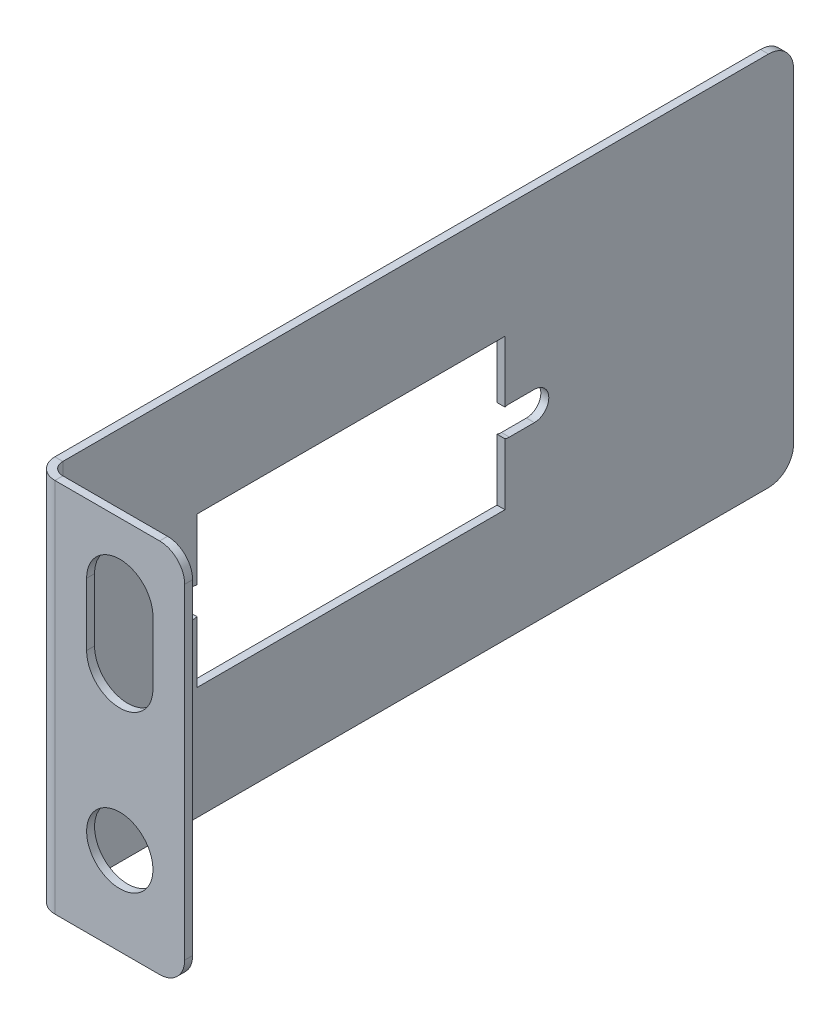
from build123d import *

# Parameters (mm, degrees)
SKETCH1_W                    = 60
SKETCH1_H                    = 30
BASE_FLANGE1_DEPTH           = 0.635
SKETCH9_W                    = 24.6
SKETCH9_H                    = 12
CUT_EXTRUDE1_DEPTH           = 34.547030047
CUT_EXTRUDE2_DEPTH           = 34.547030047
EDGE_FLANGE1_STRIP_W         = 4.54
EDGE_FLANGE1_STRIP_H         = 0.635
EDGE_FLANGE1_STRIP_CUT_DEPTH = 30
EDGE_FLANGE1_DEPTH           = 30
SKETCH14_R                   = 2.65
CUT_EXTRUDE3_DEPTH           = 63.276532097
FILLET1_R                    = 2


# Sheet-metal steps are written as plain solids
with BuildPart() as part:
    # Sketch1 → Base-Flange1 (new body)
    with BuildSketch(Plane(origin=(0, 0, 0), x_dir=(0, 0, -1), z_dir=(1, 0, 0))):
        Rectangle(SKETCH1_W, SKETCH1_H)
    extrude(amount=-BASE_FLANGE1_DEPTH)

    # Sketch9 → Cut-Extrude1 (cut, through all)
    with BuildSketch(Plane(origin=(0, 0, 0), x_dir=(0, 0, -1), z_dir=(1, 0, 0))):
        with Locations((-5.35, 0)):
            Rectangle(SKETCH9_W, SKETCH9_H)
    extrude(amount=-CUT_EXTRUDE1_DEPTH, mode=Mode.SUBTRACT)

    # Sketch10 → Cut-Extrude2 (cut, through all)
    with BuildSketch(Plane.ZY.offset(0.635)):
        with BuildLine():
            Line((-9.3, 1.15), (-7.3, 1.15))
            ThreePointArc((-7.3, 1.15), (-6.15, 0), (-7.3, -1.15))
            Line((-7.3, -1.15), (-9.3, -1.15))
            ThreePointArc((-9.3, -1.15), (-10.45, 0), (-9.3, 1.15))
        make_face()
        with BuildLine():
            Line((18, 1.15), (20, 1.15))
            ThreePointArc((20, 1.15), (21.15, 0), (20, -1.15))
            Line((20, -1.15), (18, -1.15))
            ThreePointArc((18, -1.15), (16.85, 0), (18, 1.15))
        make_face()
    extrude(amount=-CUT_EXTRUDE2_DEPTH, mode=Mode.SUBTRACT)

    # Edge-Flange1 strip (across the edge) → Edge-Flange1 strip cut (cut)
    with BuildSketch(Plane(origin=(0, 15, 30), x_dir=(0, 0, -1), z_dir=(0, -1, 0))):
        with Locations((-0.635, -0.3175)):
            Rectangle(EDGE_FLANGE1_STRIP_W, EDGE_FLANGE1_STRIP_H)
    extrude(amount=EDGE_FLANGE1_STRIP_CUT_DEPTH, mode=Mode.SUBTRACT)

    # Edge-Flange1 section (across the edge) → Edge-Flange1 (add)
    with BuildSketch(Plane(origin=(0, 15, 30), x_dir=(0, 0, -1), z_dir=(0, -1, 0))):
        with BuildLine():
            Line((0, 1), (0, 11.365))
            Line((0, 11.365), (0.635, 11.365))
            Line((0.635, 11.365), (0.635, 1))
            ThreePointArc((0.635, 1), (0.927893219, 0.292893219), (1.635, 0))
            Line((1.635, 0), (1.635, -0.635))
            ThreePointArc((1.635, -0.635), (0.478880413, -0.156119587), (0, 1))
        make_face()
    extrude(amount=EDGE_FLANGE1_DEPTH)

    # Sketch14 → Cut-Extrude3 (cut, through all)
    with BuildSketch(Plane(origin=(0, 0, 29.365), x_dir=(-1, 0, 0), z_dir=(0, 0, -1))):
        with Locations((-6.1825, -8)):
            Circle(SKETCH14_R)
        with BuildLine():
            Line((-8.8325, 4.5), (-8.8325, 9.5))
            ThreePointArc((-8.8325, 9.5), (-6.1825, 12.15), (-3.5325, 9.5))
            Line((-3.5325, 9.5), (-3.5325, 4.5))
            ThreePointArc((-3.5325, 4.5), (-6.1825, 1.85), (-8.8325, 4.5))
        make_face()
    extrude(amount=-CUT_EXTRUDE3_DEPTH, mode=Mode.SUBTRACT)

    # Fillet1
    fillet1_edges = [part.edges().sort_by_distance(p)[0] for p in [
        (11.365, 15, 29.6825),
        (11.365, -15, 29.6825),
        (-0.3175, -15, -30),
        (-0.3175, 15, -30),
    ]]
    fillet(fillet1_edges, radius=FILLET1_R)


solid = part.part
